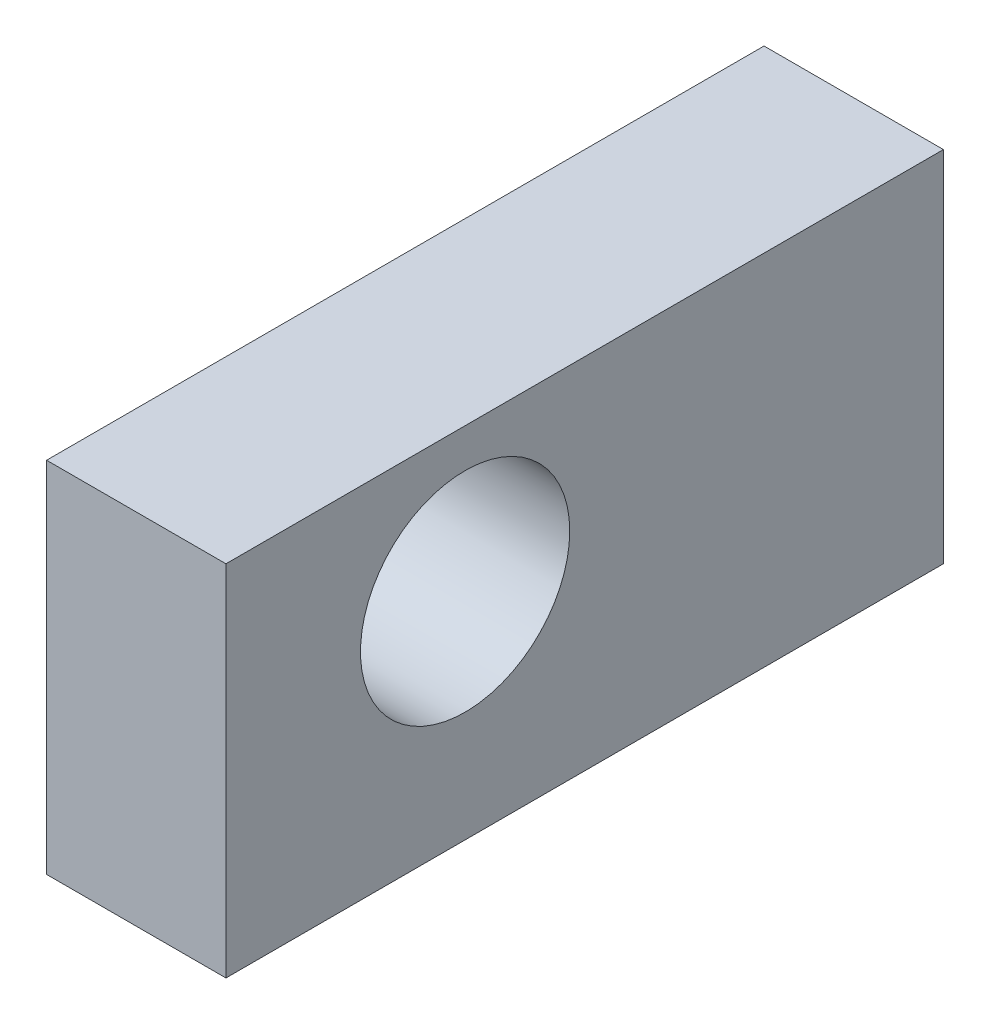
from build123d import *

# Parameters (mm, degrees)
SKETCH1_W                          = 38.1
SKETCH1_H                          = 19.05
BOSS_EXTRUDE1_DEPTH                = 9.525
F_7_16_0_4375_DIAMETER_HOLE1_D     = 11.1125
F_7_16_0_4375_DIAMETER_HOLE1_DEPTH = 70.104
F_7_16_0_4375_DIAMETER_HOLE1_TIP   = 3.338531814
F_10_32_TAPPED_HOLE1_D             = 4.0386
F_10_32_TAPPED_HOLE1_DEPTH         = 11.938
F_10_32_TAPPED_HOLE1_TIP           = 1.213317848


with BuildPart() as part:
    # Sketch1 → Boss-Extrude1 (new body)
    with BuildSketch(Plane(origin=(0, 0, 0), x_dir=(0, 0, -1), z_dir=(1, 0, 0))):
        Rectangle(SKETCH1_W, SKETCH1_H)
    extrude(amount=BOSS_EXTRUDE1_DEPTH)

    # 7/16 (0.4375) Diameter Hole1
    with Locations(Plane(origin=(9.525, 0, 0), x_dir=(0, 0, -1), z_dir=(1, 0, 0))):
        with Locations((-6.35, 1.905)):
            Hole(F_7_16_0_4375_DIAMETER_HOLE1_D / 2, depth=F_7_16_0_4375_DIAMETER_HOLE1_DEPTH)
            with Locations((0, 0, -(F_7_16_0_4375_DIAMETER_HOLE1_DEPTH + F_7_16_0_4375_DIAMETER_HOLE1_TIP / 2))):  # 118° drill point
                Cone(0, F_7_16_0_4375_DIAMETER_HOLE1_D / 2, F_7_16_0_4375_DIAMETER_HOLE1_TIP, mode=Mode.SUBTRACT)

    # #10-32 Tapped Hole1
    with Locations(Plane(origin=(-1.136463696, 0.51181849, -19.05), x_dir=(-1, 0, 0), z_dir=(0, 0, -1))):
        with Locations((-5.898963696, -3.68681849), (-5.898963696, 5.20318151)):
            Hole(F_10_32_TAPPED_HOLE1_D / 2, depth=F_10_32_TAPPED_HOLE1_DEPTH)
            with Locations((0, 0, -(F_10_32_TAPPED_HOLE1_DEPTH + F_10_32_TAPPED_HOLE1_TIP / 2))):  # 118° drill point
                Cone(0, F_10_32_TAPPED_HOLE1_D / 2, F_10_32_TAPPED_HOLE1_TIP, mode=Mode.SUBTRACT)


solid = part.part
